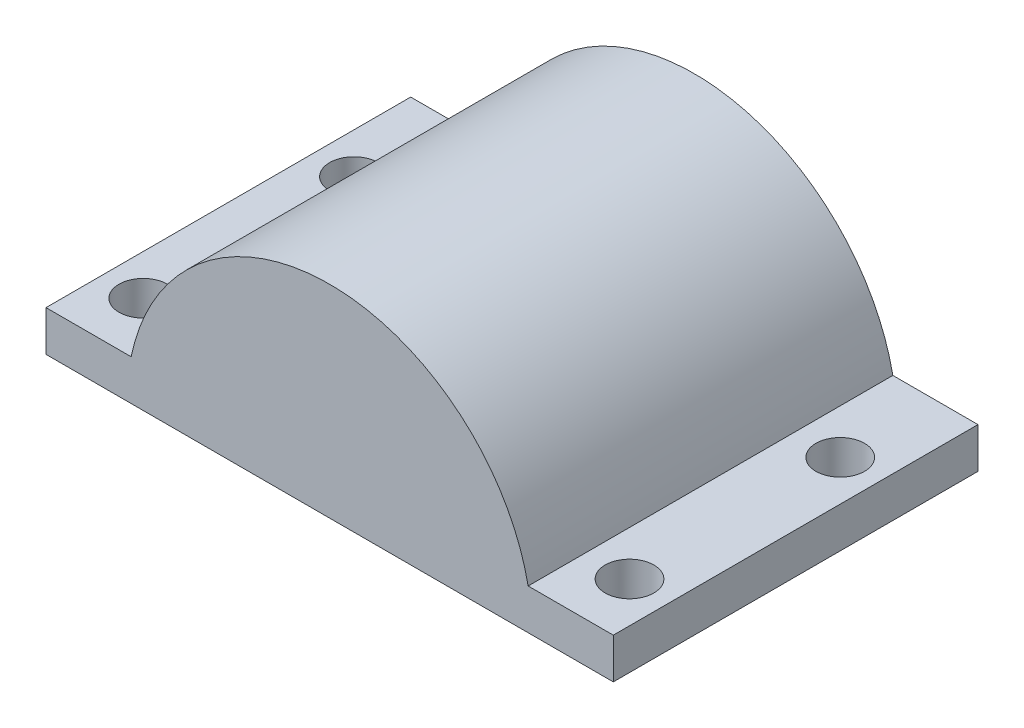
from build123d import *

# Parameters (mm, degrees)
SKETCH1_W                 = 70
SKETCH1_H                 = 50
BOSS_EXTRUDE1_DEPTH       = 30
CAVITY1_START             = -20
CAVITY1_DEPTH             = 40
CAVITY1_START_2           = -25
CAVITY1_2_DEPTH           = 5
CUT_EXTRUDE1_DEPTH        = 65.420493634
CUT_EXTRUDE1_DEPTH_BACK   = 65.420493634
F_6_0MM_DOWEL_HOLE1_D     = 6
F_6_0MM_DOWEL_HOLE1_DEPTH = 10
F_6_0MM_DOWEL_HOLE1_TIP   = 1.802581857
CUT_EXTRUDE3_DEPTH        = 5


# Read off the part's stored shape, not the designer's step: Cavity1
with BuildPart() as part:
    # Sketch1 → Boss-Extrude1 (new body)
    with BuildSketch(Plane(origin=(0, 0, 0), x_dir=(1, 0, 0), z_dir=(0, 1, 0))):
        Rectangle(SKETCH1_W, SKETCH1_H)
    extrude(amount=BOSS_EXTRUDE1_DEPTH)

    # Cavity1 outline → Cavity1 (cut)
    with BuildSketch(Plane.XY.offset(CAVITY1_START)):
        with BuildLine():
            ThreePointArc((20, 0), (0, 20), (-20, 0))
            Line((-20, 0), (20, 0))
        make_face()
    extrude(amount=CAVITY1_DEPTH, mode=Mode.SUBTRACT)

    # Cavity1 2 outline → Cavity1 2 (cut)
    with BuildSketch(Plane.XY.offset(CAVITY1_START_2)):
        with BuildLine():
            Line((-10, 0), (10, 0))
            ThreePointArc((10, 0), (0, 10), (-10, 0))
        make_face()
    extrude(amount=CAVITY1_2_DEPTH, mode=Mode.SUBTRACT)

    # Sketch2 → Cut-Extrude1 (cut, two sides: drawn at the far end of the back side and taken through both)
    with BuildSketch(Plane(origin=(0, 0, 20), x_dir=(-1, 0, 0), z_dir=(0, 0, -1)).offset(-CUT_EXTRUDE1_DEPTH_BACK)):
        with BuildLine():
            Line((-35, 30), (-35, 5))
            Line((-35, 5), (-24.494897428, 5))
            ThreePointArc((-24.494897428, 5), (0, 25), (24.494897428, 5))
            Line((24.494897428, 5), (35, 5))
            Line((35, 5), (35, 30))
            Line((35, 30), (-35, 30))
        make_face()
    extrude(amount=CUT_EXTRUDE1_DEPTH + CUT_EXTRUDE1_DEPTH_BACK, mode=Mode.SUBTRACT)

    # Ø6.0mm Dowel Hole1
    with Locations(Plane(origin=(0, 0, 0), x_dir=(-1, 0, 0), z_dir=(0, -1, 0))):
        with Locations((-30, 8), (-30, -18), (30, 8), (30, -18)):
            Hole(F_6_0MM_DOWEL_HOLE1_D / 2, depth=F_6_0MM_DOWEL_HOLE1_DEPTH)
            with Locations((0, 0, -(F_6_0MM_DOWEL_HOLE1_DEPTH + F_6_0MM_DOWEL_HOLE1_TIP / 2))):  # 118° drill point
                Cone(0, F_6_0MM_DOWEL_HOLE1_D / 2, F_6_0MM_DOWEL_HOLE1_TIP, mode=Mode.SUBTRACT)

    # Sketch6 → Cut-Extrude3 (cut)
    with BuildSketch(Plane(origin=(0, 0, -25), x_dir=(-1, 0, 0), z_dir=(0, 0, -1))):
        with BuildLine():
            Line((35, 5), (24.494897428, 5))
            ThreePointArc((24.494897428, 5), (0, 25), (-24.494897428, 5))
            Line((-24.494897428, 5), (-35, 5))
            Line((-35, 5), (-35, 0))
            Line((-35, 0), (-10, 0))
            ThreePointArc((-10, 0), (0, 10), (10, 0))
            Line((10, 0), (35, 0))
            Line((35, 0), (35, 5))
        make_face()
    extrude(amount=-CUT_EXTRUDE3_DEPTH, mode=Mode.SUBTRACT)


solid = part.part
